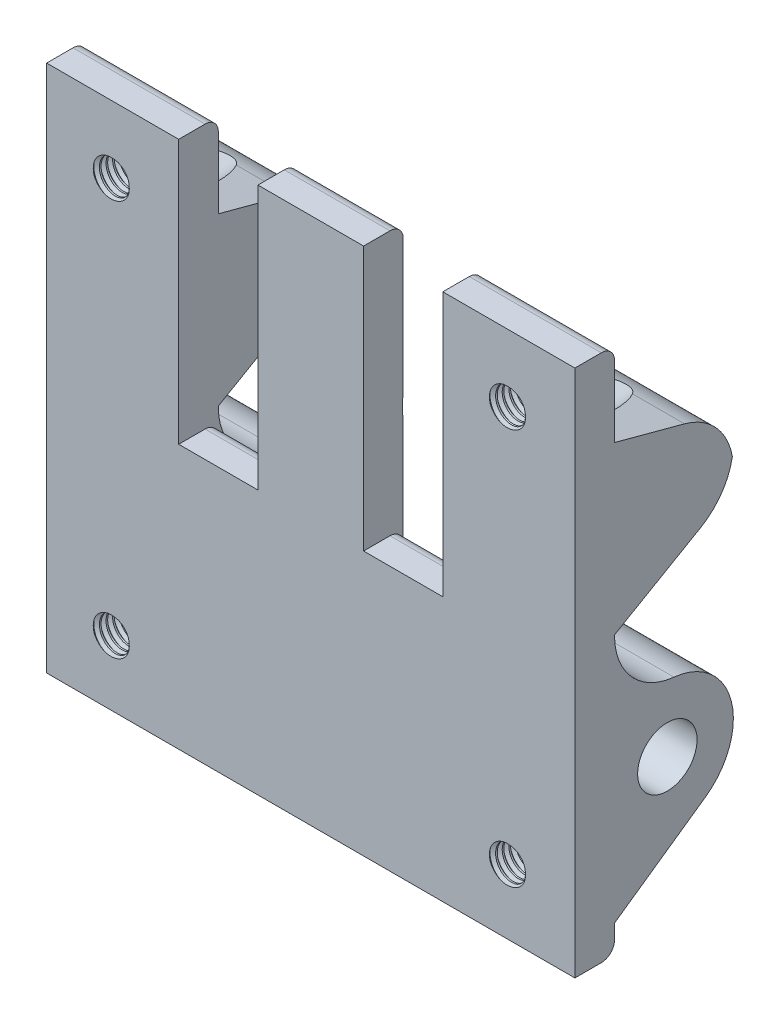
from build123d import *

# Parameters (mm, degrees)
SKETCH2_R                            = 2.25
BOSS_EXTRUDE2_DEPTH                  = 20
HINGE_CUTOUT_DEPTH                   = 47.303347611
HINGE_CUTOUT_DEPTH_BACK              = 47.303347611
SKETCH3_W                            = 20
SKETCH3_H                            = 9
SKETCH7_W                            = 1.25
SKETCH7_H                            = 3
TAP_DRILL_FOR_M3X0_5_TAP1_AT_2_COUNT = 2
TAP_DRILL_FOR_M3X0_5_TAP1_AT_2_PITCH = 30
TAP_DRILL_FOR_M3X0_5_TAP1_AT_3_COUNT = 2
TAP_DRILL_FOR_M3X0_5_TAP1_AT_3_PITCH = 42.426406871
TAP_DRILL_FOR_M3X0_5_TAP1_AT_4_COUNT = 2
TAP_DRILL_FOR_M3X0_5_TAP1_AT_4_PITCH = 30
FILLET1_R                            = 5
SKETCH14_W                           = 6
SKETCH14_H                           = 20
HINGE_TEETH_CUTOUT_DEPTH             = 46.617978912
SKETCH16_W                           = 3
SKETCH16_H                           = 40
FILL_IN_FOR_ABOVE_DEPTH              = 4
SKETCH13_R                           = 3.302
SKETCH13_R_2                         = 2.413
SPRING_CUTOUT_DEPTH                  = 2
SKETCH17_R                           = 3
CUT_EXTRUDE10_DEPTH                  = 46.617978912
FILLET2_R                            = 1
FILLET3_R                            = 1
THREAD1_PITCH                        = 0.5
THREAD2_PITCH                        = 0.5
THREAD3_PITCH                        = 0.5
THREAD4_PITCH                        = 0.5


with BuildPart() as part:
    # Sketch2 → Boss-Extrude2 (new, symmetric)
    with BuildSketch(Plane(origin=(0, 0, 0), x_dir=(0, 0, -1), z_dir=(1, 0, 0))):
        with BuildLine():
            Line((7, 16.005325711), (3, 16.005325711))
            Line((3, 16.005325711), (3, 21.005325711))
            Line((3, 21.005325711), (12, 26.201478134))
            Line((12, 26.201478134), (12, 31.201478134))
            Line((12, 31.201478134), (3, 33.613020866))
            Line((3, 33.613020866), (3, 40))
            Line((3, 40), (0, 40))
            Line((0, 40), (0, 16.005325711))
            Line((0, 16.005325711), (0, 0))
            Line((0, 0), (3, 0))
            Line((3, 0), (3, 2.100622615))
            Line((3, 2.100622615), (9.867882182, 6.90956549))
            ThreePointArc((9.867882182, 6.90956549), (11.768584754, 12.508854709), (7, 16.005325711))
        make_face()
        with Locations((7, 11.005325711)):
            Circle(SKETCH2_R, mode=Mode.SUBTRACT)
    extrude(amount=BOSS_EXTRUDE2_DEPTH, both=True)

    # Sketch3 → Hinge Cutout (cut, two sides: drawn at the far end of the back side and taken through both)
    with BuildSketch(Plane(origin=(0, 0, 0), x_dir=(1, 0, 0), z_dir=(0, 1, 0)).offset(-HINGE_CUTOUT_DEPTH_BACK)):
        with Locations((0, 7.5)):
            Rectangle(SKETCH3_W, SKETCH3_H)
    extrude(amount=HINGE_CUTOUT_DEPTH + HINGE_CUTOUT_DEPTH_BACK, mode=Mode.SUBTRACT)

    # Sketch7 → Tap Drill for M3x0.5 Tap1 (revolve, cut)
    with BuildSketch(Plane(origin=(15, 35, -3), x_dir=(0, 1, 0), z_dir=(1, 0, 0))):
        with Locations((0.625, 1.5)):
            Rectangle(SKETCH7_W, SKETCH7_H)
    tap_drill_for_m3x0_5_tap1 = revolve(axis=Axis((15, 35, -9.35), (0, 0, 1)), mode=Mode.SUBTRACT)

    # Tap Drill for M3x0.5 Tap1 at 2: Tap Drill for M3x0.5 Tap1 ×2
    with Locations(*[(0, -i * TAP_DRILL_FOR_M3X0_5_TAP1_AT_2_PITCH, 0) for i in range(1, TAP_DRILL_FOR_M3X0_5_TAP1_AT_2_COUNT)]):
        add(tap_drill_for_m3x0_5_tap1, mode=Mode.SUBTRACT)

    # Tap Drill for M3x0.5 Tap1 at 3: Tap Drill for M3x0.5 Tap1 ×2
    with Locations(*[Vector(-0.7071067811865472, -0.7071067811865479, 0) * (i * TAP_DRILL_FOR_M3X0_5_TAP1_AT_3_PITCH) for i in range(1, TAP_DRILL_FOR_M3X0_5_TAP1_AT_3_COUNT)]):
        add(tap_drill_for_m3x0_5_tap1, mode=Mode.SUBTRACT)

    # Tap Drill for M3x0.5 Tap1 at 4: Tap Drill for M3x0.5 Tap1 ×2
    with Locations(*[(-i * TAP_DRILL_FOR_M3X0_5_TAP1_AT_4_PITCH, 0, 0) for i in range(1, TAP_DRILL_FOR_M3X0_5_TAP1_AT_4_COUNT)]):
        add(tap_drill_for_m3x0_5_tap1, mode=Mode.SUBTRACT)

    # Fillet1
    # the kernel refuses this fillet: 5 mm, written as the material it adds along each edge
    with BuildSketch(Plane(origin=(-20, 16.005325711, -3), x_dir=(0, -0.005569427946240741, -0.9999844906159053), z_dir=(1, 0, 0))) as fillet1_piece_1:
        with BuildLine():
            CenterArc((4.972354484, 4.977644741), FILLET1_R, 180.319106365, 84.260829523)
            Line((-0.027567969, 4.949797602), (-0.527560214, 4.947012888))
            Line((-0.527560214, 4.947012888), (-0.499992245, -0.002784714))
            Line((-0.499992245, -0.002784714), (0.002784714, -0.499992245))
            ThreePointArc((0.002784714, -0.499992245), (4.002722676, -0.477714534), (4.452841324, -0.497764474))
            Line((4.452841324, -0.497764474), (4.500069793, 0))
        make_face()
    extrude(amount=10)
    with BuildSketch(Plane(origin=(10, 16.005325711, -3), x_dir=(0, 1, 0), z_dir=(1, 0, 0))) as fillet1_piece_2:
        with BuildLine():
            CenterArc((4.949874371, -5), FILLET1_R, 90, 84.260829523)
            Line((-0.025062814, -4.5), (-0.522556533, -4.45))
            ThreePointArc((-0.522556533, -4.45), (-0.5, -4), (-0.5, 0))
            Line((-0.5, 0), (0, 0.5))
            Line((0, 0.5), (4.949874371, 0.5))
            Line((4.949874371, 0.5), (4.949874371, 0))
        make_face()
    extrude(amount=10)
    # the kernel refuses this fillet: 5 mm, written as the material it takes off along each edge
    with BuildSketch(Plane(origin=(-27.216878365, 26.201478134, -12), x_dir=(0, 1, 0), z_dir=(1, 0, 0)), Plane(origin=(2.783121635, 26.201478134, -12), x_dir=(0, 1, 0), z_dir=(1, 0, 0))) as fillet1_2_piece_1:
        with BuildLine():
            CenterArc((FILLET1_R * 0.57735026919, FILLET1_R), FILLET1_R, 210, 60)
            Line((-FILLET1_R * 0.288675134595, FILLET1_R * 0.5), (0, 0))
            Line((0, 0), (FILLET1_R * 0.57735026919, 0))
        make_face()
    extrude(amount=24.43375673, mode=Mode.SUBTRACT)
    with BuildSketch(Plane(origin=(-29.59158735, 31.201478134, -12), x_dir=(0, 0.258819045102526, 0.9659258262890669), z_dir=(1, 0, 0)), Plane(origin=(0.40841265, 31.201478134, -12), x_dir=(0, 0.258819045102526, 0.9659258262890669), z_dir=(1, 0, 0))) as fillet1_2_piece_2:
        with BuildLine():
            CenterArc((FILLET1_R * 0.767326987979, FILLET1_R), FILLET1_R, 195, 75)
            Line((-FILLET1_R * 0.19859883831, FILLET1_R * 0.741180954897), (0, 0))
            Line((0, 0), (FILLET1_R * 0.767326987979, 0))
        make_face()
    extrude(amount=29.183174699, mode=Mode.SUBTRACT)

    # Sketch14 → Hinge Teeth cutout (cut, through all)
    with BuildSketch(Plane(origin=(0, 0, -3), x_dir=(-1, 0, 0), z_dir=(0, 0, -1))):
        with Locations((-7, 30)):
            Rectangle(SKETCH14_W, SKETCH14_H)
        with Locations((7, 30)):
            Rectangle(SKETCH14_W, SKETCH14_H)
    extrude(amount=-HINGE_TEETH_CUTOUT_DEPTH, mode=Mode.SUBTRACT)

    # Sketch16 → Fill in for above (add, symmetric)
    with BuildSketch(Plane(origin=(0, 0, 0), x_dir=(0, 0, -1), z_dir=(1, 0, 0))):
        with Locations((1.5, 20)):
            Rectangle(SKETCH16_W, SKETCH16_H)
    extrude(amount=FILL_IN_FOR_ABOVE_DEPTH, both=True)

    # Sketch13 → Spring Cutout (cut)
    with BuildSketch(Plane(origin=(0, 0, -3), x_dir=(-1, 0, 0), z_dir=(0, 0, -1))):
        with Locations(Location((0, 28, 0), (0, 0, 90))):
            Circle(SKETCH13_R)
        with Locations(Location((0, 28, 0), (0, 0, 90))):
            Circle(SKETCH13_R_2, mode=Mode.SUBTRACT)
    extrude(amount=-SPRING_CUTOUT_DEPTH, mode=Mode.SUBTRACT)

    # Sketch17 → Cut-Extrude10 (cut, through all)
    with BuildSketch(Plane(origin=(0, 0, -3), x_dir=(-1, 0, 0), z_dir=(0, 0, -1))):
        with Locations((-15, 35)):
            Circle(SKETCH17_R)
        with Locations((-15, 5)):
            Circle(SKETCH17_R)
        with Locations((15, 5)):
            Circle(SKETCH17_R)
        with Locations((15, 35)):
            Circle(SKETCH17_R)
    extrude(amount=CUT_EXTRUDE10_DEPTH, mode=Mode.SUBTRACT)

    # Fillet2
    # the kernel refuses this fillet: 1 mm, written as the material it takes off along each edge
    with BuildSketch(Plane(origin=(0, 28, -3), x_dir=(0, 1, 0), z_dir=(-1, 0, 0))) as fillet2_piece_1:
        with BuildLine():
            CenterArc((3.302 + FILLET2_R, -FILLET2_R), FILLET2_R, 90, 90)
            Line((3.302, -FILLET2_R), (3.302, 0))
            Line((3.302, 0), (3.302 + FILLET2_R, 0))
        make_face()
    revolve(axis=Axis((0, 28, -3), (0, 0, -1)), mode=Mode.SUBTRACT)
    with BuildSketch(Plane(origin=(0, 28, -3), x_dir=(0, 1, 0), z_dir=(-1, 0, 0))) as fillet2_piece_2:
        with BuildLine():
            CenterArc((2.413 - FILLET2_R, -FILLET2_R), FILLET2_R, 0, 90)
            Line((2.413 - FILLET2_R, 0), (2.413, 0))
            Line((2.413, 0), (2.413, -FILLET2_R))
        make_face()
    revolve(axis=Axis((0, 28, -3), (0, 0, -1)), mode=Mode.SUBTRACT)

    # Fillet3
    fillet3_edges = [part.edges().sort_by_distance(p)[0] for p in [
        (0, 40, -3),
        (-15, 40, -3),
        (7, 20, -3),
        (-7, 20, -3),
        (15, 40, -3),
        (0, 0, -3),
    ]]
    fillet(fillet3_edges, radius=FILLET3_R)

    # Thread1: the profile of Thread Profile1 profile screwed along a right-hand helix of 20 turns, 6 arcs to a turn; built about Z, then put on its axis
    thread1_z = Axis((0, 0, 0), (0, 0, 1))
    thread1_corners = [(1.2497, 0, -0.000173205), (1.520632937, 0, 0.156249999), (1.520632937, 0, 0.218749999), (1.2497, 0, 0.375173204)]
    with BuildLine(mode=Mode.PRIVATE) as thread1_profile:
        Line(thread1_corners[0], thread1_corners[1])
        Line(thread1_corners[1], thread1_corners[2])
        Line(thread1_corners[2], thread1_corners[3])
        Line(thread1_corners[3], thread1_corners[0])
    thread1_cap = Face(thread1_profile.wire())
    thread1_turn_angles = [0, 30, 60, 90, 120, 150, 180, 210, 240, 270, 300, 330, 360]
    thread1_turn_weights = [1, 0.8660254037844387, 1, 0.8660254037844387, 1, 0.8660254037844387, 1, 0.8660254037844387, 1, 0.8660254037844387, 1, 0.8660254037844387, 1]
    thread1_turn_rails = [Edge.make_bspline([Vector(p[0], p[1], 0).rotate(thread1_z, thread1_turn_angles[k]) / thread1_turn_weights[k] + Vector(0, 0, p[2] + THREAD1_PITCH * thread1_turn_angles[k] / 360) for k in range(13)], [0, 0, 0, 1, 1, 2, 2, 3, 3, 4, 4, 5, 5, 6, 6, 6], 2, thread1_turn_weights) for p in thread1_corners]
    thread1_turn_sides = [Face.make_surface_from_curves(thread1_turn_rails[p[0]], thread1_turn_rails[p[1]]) for p in [(0, 1), (1, 2), (2, 3), (3, 0)]]
    thread1 = Plane(origin=(15, 5, -3), x_dir=(1, 0, 0), z_dir=(0, 0, 1)) * Solid(Shell([*[p.moved(Location((0, 0, THREAD1_PITCH * i))) for i in range(20) for p in thread1_turn_sides], thread1_cap, thread1_cap.rotate(thread1_z, 7200).moved(Location((0, 0, THREAD1_PITCH * 7200 / 360)))]))
    add(thread1, mode=Mode.SUBTRACT)

    # Thread2: the profile of Thread Profile2 profile screwed along a right-hand helix of 20 turns, 6 arcs to a turn; built about Z, then put on its axis
    thread2_z = Axis((0, 0, 0), (0, 0, 1))
    thread2_corners = [(1.2497, 0, -0.000173205), (1.520632938, 0, 0.156249999), (1.520632938, 0, 0.218749999), (1.2497, 0, 0.375173204)]
    with BuildLine(mode=Mode.PRIVATE) as thread2_profile:
        Line(thread2_corners[0], thread2_corners[1])
        Line(thread2_corners[1], thread2_corners[2])
        Line(thread2_corners[2], thread2_corners[3])
        Line(thread2_corners[3], thread2_corners[0])
    thread2_cap = Face(thread2_profile.wire())
    thread2_turn_angles = [0, 30, 60, 90, 120, 150, 180, 210, 240, 270, 300, 330, 360]
    thread2_turn_weights = [1, 0.8660254037844387, 1, 0.8660254037844387, 1, 0.8660254037844387, 1, 0.8660254037844387, 1, 0.8660254037844387, 1, 0.8660254037844387, 1]
    thread2_turn_rails = [Edge.make_bspline([Vector(p[0], p[1], 0).rotate(thread2_z, thread2_turn_angles[k]) / thread2_turn_weights[k] + Vector(0, 0, p[2] + THREAD2_PITCH * thread2_turn_angles[k] / 360) for k in range(13)], [0, 0, 0, 1, 1, 2, 2, 3, 3, 4, 4, 5, 5, 6, 6, 6], 2, thread2_turn_weights) for p in thread2_corners]
    thread2_turn_sides = [Face.make_surface_from_curves(thread2_turn_rails[p[0]], thread2_turn_rails[p[1]]) for p in [(0, 1), (1, 2), (2, 3), (3, 0)]]
    thread2 = Plane(origin=(-15, 5, -3), x_dir=(1, 0, 0), z_dir=(0, 0, 1)) * Solid(Shell([*[p.moved(Location((0, 0, THREAD2_PITCH * i))) for i in range(20) for p in thread2_turn_sides], thread2_cap, thread2_cap.rotate(thread2_z, 7200).moved(Location((0, 0, THREAD2_PITCH * 7200 / 360)))]))
    add(thread2, mode=Mode.SUBTRACT)

    # Thread3: the profile of Thread Profile3 profile screwed along a right-hand helix of 20 turns, 6 arcs to a turn; built about Z, then put on its axis
    thread3_z = Axis((0, 0, 0), (0, 0, 1))
    thread3_corners = [(1.2497, 0, -0.000173205), (1.520632938, 0, 0.156249999), (1.520632938, 0, 0.218749999), (1.2497, 0, 0.375173204)]
    with BuildLine(mode=Mode.PRIVATE) as thread3_profile:
        Line(thread3_corners[0], thread3_corners[1])
        Line(thread3_corners[1], thread3_corners[2])
        Line(thread3_corners[2], thread3_corners[3])
        Line(thread3_corners[3], thread3_corners[0])
    thread3_cap = Face(thread3_profile.wire())
    thread3_turn_angles = [0, 30, 60, 90, 120, 150, 180, 210, 240, 270, 300, 330, 360]
    thread3_turn_weights = [1, 0.8660254037844387, 1, 0.8660254037844387, 1, 0.8660254037844387, 1, 0.8660254037844387, 1, 0.8660254037844387, 1, 0.8660254037844387, 1]
    thread3_turn_rails = [Edge.make_bspline([Vector(p[0], p[1], 0).rotate(thread3_z, thread3_turn_angles[k]) / thread3_turn_weights[k] + Vector(0, 0, p[2] + THREAD3_PITCH * thread3_turn_angles[k] / 360) for k in range(13)], [0, 0, 0, 1, 1, 2, 2, 3, 3, 4, 4, 5, 5, 6, 6, 6], 2, thread3_turn_weights) for p in thread3_corners]
    thread3_turn_sides = [Face.make_surface_from_curves(thread3_turn_rails[p[0]], thread3_turn_rails[p[1]]) for p in [(0, 1), (1, 2), (2, 3), (3, 0)]]
    thread3 = Plane(origin=(-15, 35, -3), x_dir=(1, 0, 0), z_dir=(0, 0, 1)) * Solid(Shell([*[p.moved(Location((0, 0, THREAD3_PITCH * i))) for i in range(20) for p in thread3_turn_sides], thread3_cap, thread3_cap.rotate(thread3_z, 7200).moved(Location((0, 0, THREAD3_PITCH * 7200 / 360)))]))
    add(thread3, mode=Mode.SUBTRACT)

    # Thread4: the profile of Thread Profile4 profile screwed along a right-hand helix of 20 turns, 6 arcs to a turn; built about Z, then put on its axis
    thread4_z = Axis((0, 0, 0), (0, 0, 1))
    thread4_corners = [(1.2497, 0, -0.000173205), (1.520632937, 0, 0.156249999), (1.520632937, 0, 0.218749999), (1.2497, 0, 0.375173204)]
    with BuildLine(mode=Mode.PRIVATE) as thread4_profile:
        Line(thread4_corners[0], thread4_corners[1])
        Line(thread4_corners[1], thread4_corners[2])
        Line(thread4_corners[2], thread4_corners[3])
        Line(thread4_corners[3], thread4_corners[0])
    thread4_cap = Face(thread4_profile.wire())
    thread4_turn_angles = [0, 30, 60, 90, 120, 150, 180, 210, 240, 270, 300, 330, 360]
    thread4_turn_weights = [1, 0.8660254037844387, 1, 0.8660254037844387, 1, 0.8660254037844387, 1, 0.8660254037844387, 1, 0.8660254037844387, 1, 0.8660254037844387, 1]
    thread4_turn_rails = [Edge.make_bspline([Vector(p[0], p[1], 0).rotate(thread4_z, thread4_turn_angles[k]) / thread4_turn_weights[k] + Vector(0, 0, p[2] + THREAD4_PITCH * thread4_turn_angles[k] / 360) for k in range(13)], [0, 0, 0, 1, 1, 2, 2, 3, 3, 4, 4, 5, 5, 6, 6, 6], 2, thread4_turn_weights) for p in thread4_corners]
    thread4_turn_sides = [Face.make_surface_from_curves(thread4_turn_rails[p[0]], thread4_turn_rails[p[1]]) for p in [(0, 1), (1, 2), (2, 3), (3, 0)]]
    thread4 = Plane(origin=(15, 35, -3), x_dir=(1, 0, 0), z_dir=(0, 0, 1)) * Solid(Shell([*[p.moved(Location((0, 0, THREAD4_PITCH * i))) for i in range(20) for p in thread4_turn_sides], thread4_cap, thread4_cap.rotate(thread4_z, 7200).moved(Location((0, 0, THREAD4_PITCH * 7200 / 360)))]))
    add(thread4, mode=Mode.SUBTRACT)


solid = part.part
